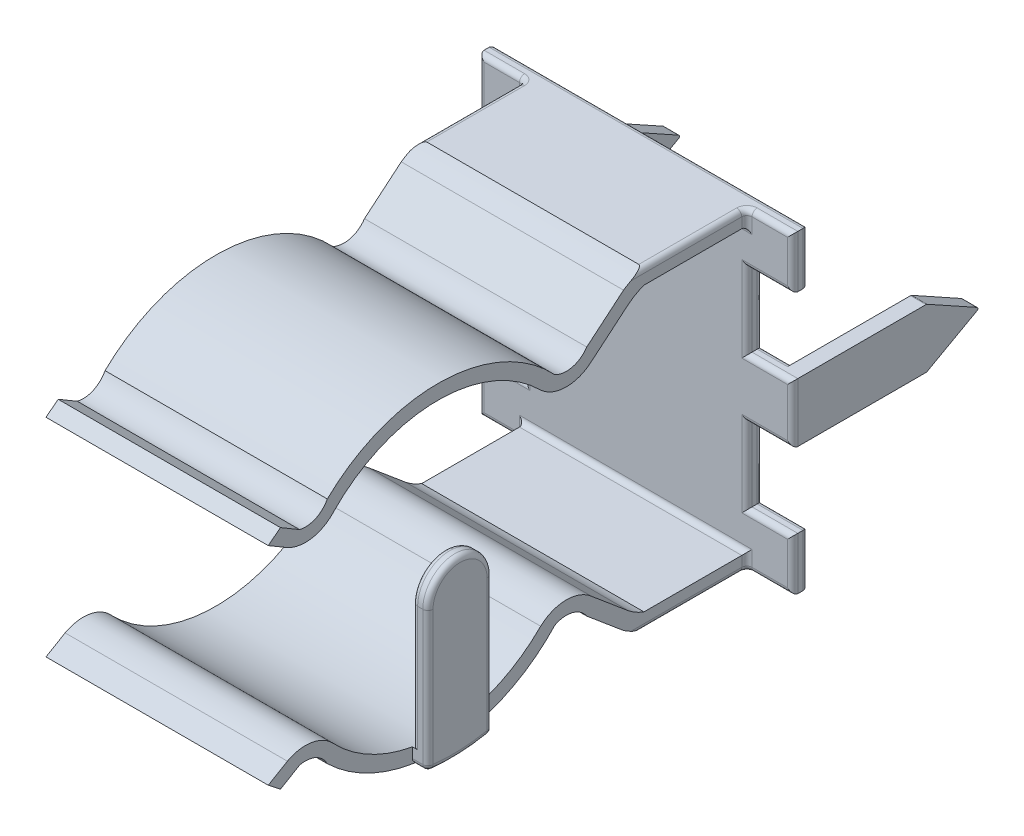
from build123d import *
from OCP.BRepFilletAPI import BRepFilletAPI_MakeChamfer

# Parameters (mm, degrees)
SKETCH1_W      = 6.096
SKETCH1_H      = 6.096
EXTRUDE1_DEPTH = 0.3
SKETCH7_W      = 4.318
SKETCH7_H      = 0.3
EXTRUDE2_DEPTH = 2
EXTRUDE3_REACH = 6.752
SKETCH8_W      = 0.889
SKETCH8_H      = 1.4605
SKETCH9_W      = 0.3
SKETCH9_H      = 1.143
EXTRUDE4_DEPTH = 3.302
CHAMFER1_SIZE  = 1
CHAMFER1_SIZE2 = 0.554309051
FILLET1_R      = 0.05
SWEEP1_START   = -2.159
SWEEP1_DEPTH   = 4.318
EXTRUDE5_DEPTH = 0.3
FILLET9_R      = 0.1


# Read off the part's stored shape, not the designer's step: Sweep1
with BuildPart() as part:
    # Sketch1 → Extrude1 (new body)
    with BuildSketch(Plane.XY):
        Rectangle(SKETCH1_W, SKETCH1_H)
    extrude(amount=EXTRUDE1_DEPTH)

    # Sketch7 → Extrude2 (add)
    with BuildSketch(Plane.XY.offset(0.3)):
        with Locations((0, 2.898)):
            Rectangle(SKETCH7_W, SKETCH7_H)
        with Locations((0, -2.898)):
            Rectangle(SKETCH7_W, SKETCH7_H)
    extrude(amount=EXTRUDE2_DEPTH)

    # Sketch8 → Extrude3 (cut, up to next)
    with BuildSketch(Plane.XY.offset(0.3), mode=Mode.PRIVATE) as extrude3_sk1:
        with Locations((2.6035, 1.30175)):
            Rectangle(SKETCH8_W, SKETCH8_H)
    extrude3_tool1 = extrude(extrude3_sk1.sketch, amount=-EXTRUDE3_REACH, mode=Mode.PRIVATE) & part.part
    # Sketch8 → Extrude3 (cut, up to next)
    with BuildSketch(Plane.XY.offset(0.3), mode=Mode.PRIVATE) as extrude3_sk2:
        with Locations((2.6035, -1.30175)):
            Rectangle(SKETCH8_W, SKETCH8_H)
    extrude3_tool2 = extrude(extrude3_sk2.sketch, amount=-EXTRUDE3_REACH, mode=Mode.PRIVATE) & part.part
    # Sketch8 → Extrude3 (cut, up to next)
    with BuildSketch(Plane.XY.offset(0.3), mode=Mode.PRIVATE) as extrude3_sk3:
        with Locations((-2.6035, 1.30175)):
            Rectangle(SKETCH8_W, SKETCH8_H)
    extrude3_tool3 = extrude(extrude3_sk3.sketch, amount=-EXTRUDE3_REACH, mode=Mode.PRIVATE) & part.part
    # Sketch8 → Extrude3 (cut, up to next)
    with BuildSketch(Plane.XY.offset(0.3), mode=Mode.PRIVATE) as extrude3_sk4:
        with Locations((-2.6035, -1.30175)):
            Rectangle(SKETCH8_W, SKETCH8_H)
    extrude3_tool4 = extrude(extrude3_sk4.sketch, amount=-EXTRUDE3_REACH, mode=Mode.PRIVATE) & part.part
    add(extrude3_tool1.solids().sort_by_distance((2.6035, 1.30175, 0.3))[0], mode=Mode.SUBTRACT)
    add(extrude3_tool2.solids().sort_by_distance((2.6035, -1.30175, 0.3))[0], mode=Mode.SUBTRACT)
    add(extrude3_tool3.solids().sort_by_distance((-2.6035, 1.30175, 0.3))[0], mode=Mode.SUBTRACT)
    add(extrude3_tool4.solids().sort_by_distance((-2.6035, -1.30175, 0.3))[0], mode=Mode.SUBTRACT)

    # Sketch9 → Extrude4 (add)
    with BuildSketch(Plane(origin=(0, 0, 0), x_dir=(-1, 0, 0), z_dir=(0, 0, -1))):
        with Locations((-2.898, 0)):
            Rectangle(SKETCH9_W, SKETCH9_H)
        with Locations((2.898, 0)):
            Rectangle(SKETCH9_W, SKETCH9_H)
    extrude(amount=EXTRUDE4_DEPTH)

    # Chamfer1: one chamfer whose edges measure the first distance from different faces: ONE call of the kernel's chamfer builder (chamfer() names one face for all edges)
    chamfer1_edges_1 = [part.edges().sort_by_distance(p)[0] for p in [
        (-2.898, 0.5715, -3.302),
    ]]
    chamfer1_side_1 = [part.faces().sort_by_distance(p)[0] for p in [
        (-2.835530303, 0.5715, -1.268969697),
    ]]
    chamfer1_edges_2 = [part.edges().sort_by_distance(p)[0] for p in [
        (-2.898, -0.5715, -3.302),
    ]]
    chamfer1_side_2 = [part.faces().sort_by_distance(p)[0] for p in [
        (-2.835530303, -0.5715, -1.268969697),
    ]]
    chamfer1_edges_3 = [part.edges().sort_by_distance(p)[0] for p in [
        (2.898, 0.5715, -3.302),
    ]]
    chamfer1_side_3 = [part.faces().sort_by_distance(p)[0] for p in [
        (2.835530303, 0.5715, -1.268969697),
    ]]
    chamfer1_edges_4 = [part.edges().sort_by_distance(p)[0] for p in [
        (2.898, -0.5715, -3.302),
    ]]
    chamfer1_side_4 = [part.faces().sort_by_distance(p)[0] for p in [
        (2.835530303, -0.5715, -1.268969697),
    ]]
    chamfer1 = BRepFilletAPI_MakeChamfer(part.part.solid().wrapped)
    for e in chamfer1_edges_1:
        chamfer1.Add(CHAMFER1_SIZE, CHAMFER1_SIZE2, e.wrapped, chamfer1_side_1[0].wrapped)  # the first distance lies on this face
    for e in chamfer1_edges_2:
        chamfer1.Add(CHAMFER1_SIZE, CHAMFER1_SIZE2, e.wrapped, chamfer1_side_2[0].wrapped)  # the first distance lies on this face
    for e in chamfer1_edges_3:
        chamfer1.Add(CHAMFER1_SIZE, CHAMFER1_SIZE2, e.wrapped, chamfer1_side_3[0].wrapped)  # the first distance lies on this face
    for e in chamfer1_edges_4:
        chamfer1.Add(CHAMFER1_SIZE, CHAMFER1_SIZE2, e.wrapped, chamfer1_side_4[0].wrapped)  # the first distance lies on this face
    add(Compound.cast(chamfer1.Shape()), mode=Mode.REPLACE)

    # Fillet1
    # the kernel refuses this fillet: 0.05 mm, written as the material it takes off along each edge
    with BuildSketch(Plane(origin=(2.715672802, -0.5715, -2.302), x_dir=(0, 0, 1), z_dir=(1, 0, 0)), Plane(origin=(3.080327198, 0.5715, -2.302), x_dir=(0, 0, 1), z_dir=(-1, 0, 0))) as fillet1_piece_1:
        with BuildLine():
            CenterArc((FILLET1_R * 0.258617584356, -FILLET1_R), FILLET1_R, 90, 29)
            Line((-FILLET1_R * 0.22619203589, -FILLET1_R * 0.125380292861), (0, 0))
            Line((0, 0), (FILLET1_R * 0.258617584356, 0))
        make_face()
    extrude(amount=0.364654396, mode=Mode.SUBTRACT)
    with BuildSketch(Plane(origin=(-2.715672802, -0.5715, -2.302), x_dir=(0, 0, 1), z_dir=(-1, 0, 0)), Plane(origin=(-3.080327198, 0.5715, -2.302), x_dir=(0, 0, 1), z_dir=(1, 0, 0))) as fillet1_piece_2:
        with BuildLine():
            CenterArc((FILLET1_R * 0.258617584356, FILLET1_R), FILLET1_R, 241, 29)
            Line((-FILLET1_R * 0.22619203589, FILLET1_R * 0.125380292861), (0, 0))
            Line((0, 0), (FILLET1_R * 0.258617584356, 0))
        make_face()
    extrude(amount=0.364654396, mode=Mode.SUBTRACT)
    with BuildSketch(Plane(origin=(-3.121630627, 0.017190949, -3.302), x_dir=(0, 0.484809620246335, 0.874619707139397), z_dir=(1, 0, 0)), Plane(origin=(-2.674369373, -0.017190949, -3.302), x_dir=(0, -0.4848096202463407, 0.8746197071393937), z_dir=(-1, 0, 0))) as fillet1_piece_3:
        with BuildLine():
            CenterArc((FILLET1_R * 0.589045016421, FILLET1_R), FILLET1_R, 209, 61)
            Line((-FILLET1_R * 0.285574690719, FILLET1_R * 0.515190379754), (0, 0))
            Line((0, 0), (FILLET1_R * 0.589045016421, 0))
        make_face()
    extrude(amount=0.447261254, mode=Mode.SUBTRACT)
    with BuildSketch(Plane(origin=(2.674369373, -0.017190949, -3.302), x_dir=(0, -0.484809620246335, 0.874619707139397), z_dir=(1, 0, 0)), Plane(origin=(3.121630627, 0.017190949, -3.302), x_dir=(0, 0.484809620246335, 0.874619707139397), z_dir=(-1, 0, 0))) as fillet1_piece_4:
        with BuildLine():
            CenterArc((FILLET1_R * 0.589045016421, -FILLET1_R), FILLET1_R, 90, 61)
            Line((-FILLET1_R * 0.285574690719, -FILLET1_R * 0.515190379754), (0, 0))
            Line((0, 0), (FILLET1_R * 0.589045016421, 0))
        make_face()
    extrude(amount=0.447261254, mode=Mode.SUBTRACT)

    # Sweep1 outline → Sweep1 (add)
    with BuildSketch(Plane.YZ.offset(SWEEP1_START)):
        with BuildLine():
            Line((2.201022161, 9.362228798), (2.015616232, 9.598077566))
            Line((2.015616232, 9.598077566), (1.796978045, 9.226668019))
            ThreePointArc((1.796978045, 9.226668019), (1.718536589, 8.747530083), (1.955330814, 8.323673128))
            ThreePointArc((1.955330814, 8.323673128), (2.813913925, 6.321446264), (1.985948752, 4.30636536))
            ThreePointArc((1.985948752, 4.30636536), (1.791066475, 3.8118654), (1.979740324, 3.314963508))
            Line((1.979740324, 3.314963508), (2.57903, 2.600757883))
            ThreePointArc((2.57903, 2.600757883), (2.675783133, 2.457271351), (2.748, 2.3))
            Line((2.748, 2.3), (3.048, 2.3))
            ThreePointArc((3.048, 2.3), (2.971816215, 2.505896596), (2.863267237, 2.696722424))
            Line((2.863267237, 2.696722424), (2.263977561, 3.410928049))
            ThreePointArc((2.263977561, 3.410928049), (2.065880045, 3.691542911), (2.108225261, 4.032415629))
            ThreePointArc((2.108225261, 4.032415629), (3.095099905, 6.216878369), (2.226894553, 8.451160915))
            ThreePointArc((2.226894553, 8.451160915), (2.010441852, 8.67831074), (1.982383975, 8.990819252))
            Line((1.982383975, 8.990819252), (2.201022161, 9.362228798))
        make_face()
    sweep1 = extrude(amount=SWEEP1_DEPTH)

    # Mirror1: Sweep1 across plane
    add(sweep1.mirror(Plane.ZX))

    # Sketch13 → Extrude5 (add)
    with BuildSketch(Plane(origin=(2.159, 0, 0), x_dir=(0, 0, -1), z_dir=(1, 0, 0))):
        with BuildLine():
            Line((-6.796694033, -3.056116436), (-6.796694033, -0.356116436))
            ThreePointArc((-6.796694033, -0.356116436), (-6.171694033, 0.268883564), (-5.546694033, -0.356116436))
            Line((-5.546694033, -0.356116436), (-5.546694033, -3.003178774))
            ThreePointArc((-5.546694033, -3.003178774), (-6.169349651, -3.085004739), (-6.796694033, -3.056116436))
        make_face()
    extrude(amount=EXTRUDE5_DEPTH)

    # Fillet9
    fillet9_edges = [part.edges().sort_by_distance(p)[0] for p in [
        (2.459, -1.679647605, 5.546694033),
        (2.459, 0.268883564, 6.171694033),
        (2.159, -1.562964944, 6.796694033),
        (2.159, 0.268883564, 6.171694033),
        (-2.6035, 0.5715, 0.3),
        (-2.159, 1.30175, 0.3),
        (-2.6035, 2.032, 0.3),
        (-3.048, 2.54, 0.3),
        (-2.6035, 3.048, 0.3),
        (-2.159, 2.898, 0.3),
        (0, 2.748, 0.3),
        (2.159, 2.898, 0.3),
        (2.6035, 3.048, 0.3),
        (3.048, 2.54, 0.3),
        (2.6035, 2.032, 0.3),
        (2.159, 1.30175, 0.3),
        (2.6035, 0.5715, 0.3),
        (3.048, 0, 0.3),
        (2.6035, -0.5715, 0.3),
        (2.159, -1.30175, 0.3),
        (2.6035, -2.032, 0.3),
        (3.048, -2.54, 0.3),
        (2.6035, -3.048, 0.3),
        (2.159, -2.898, 0.3),
        (0, -2.748, 0.3),
        (-2.159, -2.898, 0.3),
        (-2.6035, -3.048, 0.3),
        (-3.048, -2.54, 0.3),
        (-2.6035, -2.032, 0.3),
        (-2.159, -1.30175, 0.3),
        (-2.6035, -0.5715, 0.3),
        (-3.048, 0, 0.3),
        (-2.6035, -2.032, 0),
        (-3.048, -2.54, 0),
        (0, -3.048, 0),
        (3.048, -2.54, 0),
        (2.6035, -2.032, 0),
        (2.159, -1.30175, 0),
        (2.4535, 0.5715, 0),
        (2.159, 1.30175, 0),
        (2.6035, 2.032, 0),
        (3.048, 2.54, 0),
        (0, 3.048, 0),
        (-3.048, 2.54, 0),
        (-2.6035, 2.032, 0),
        (-2.159, 1.30175, 0),
        (-2.159, -1.30175, 0),
        (-2.4535, -0.5715, 0),
        (-2.4535, 0.5715, 0),
        (2.4535, -0.5715, 0),
        (2.159, 3.048, 1.3),
        (-2.159, 3.048, 1.3),
        (-2.159, -3.048, 1.3),
        (2.159, -3.048, 1.3),
        (2.459, -3.085004739, 6.169349651),
        (2.459, -1.706116436, 6.796694033),
        (2.159, -1.533703972, 5.546694033),
        (2.309, -3.003178774, 5.546694033),
        (2.309, -3.056116436, 6.796694033),
    ]]
    fillet(fillet9_edges, radius=FILLET9_R)


solid = part.part
